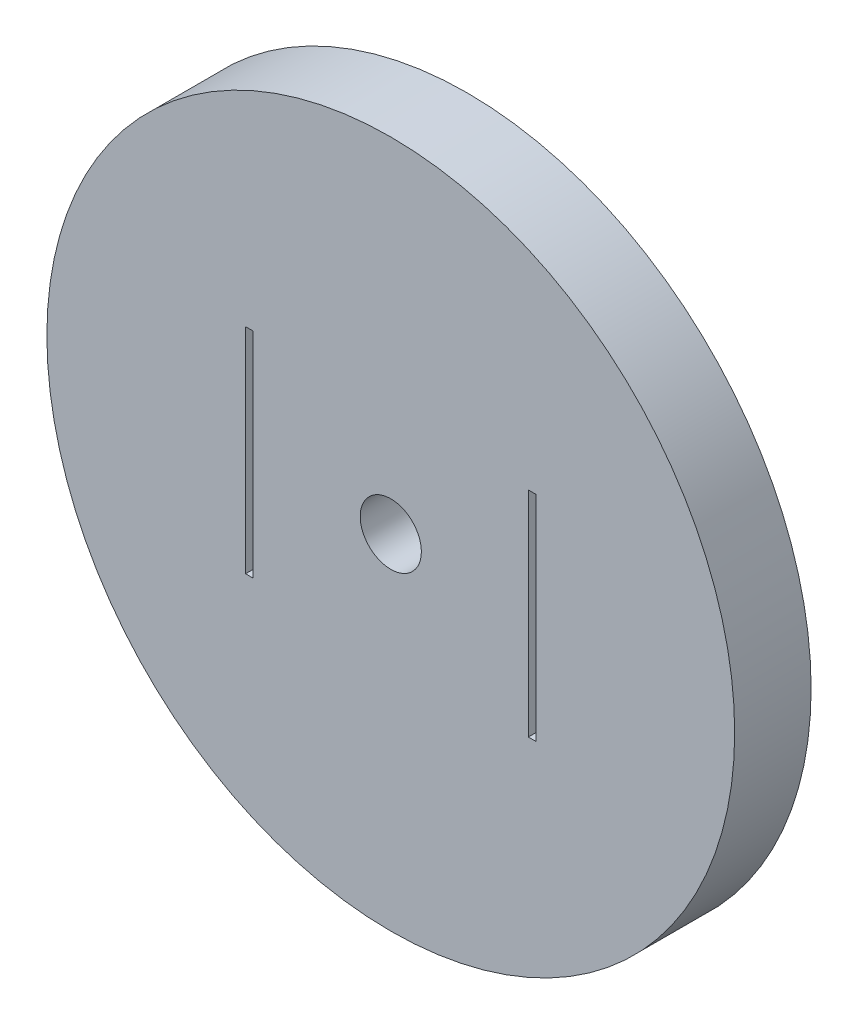
from build123d import *

# Parameters (mm, degrees)
SKETCH1_R           = 22.5
SKETCH1_R_2         = 2
SKETCH1_W           = 0.5
SKETCH1_H           = 14
BOSS_EXTRUDE1_DEPTH = 5


with BuildPart() as part:
    # Sketch1 → Boss-Extrude1 (new body)
    with BuildSketch(Plane.XY):
        Circle(SKETCH1_R)
        Circle(SKETCH1_R_2, mode=Mode.SUBTRACT)
        with Locations((-9.25, 0)):
            Rectangle(SKETCH1_W, SKETCH1_H, mode=Mode.SUBTRACT)
        with Locations((9.25, 0)):
            Rectangle(SKETCH1_W, SKETCH1_H, mode=Mode.SUBTRACT)
    extrude(amount=BOSS_EXTRUDE1_DEPTH)

    # Sketch3 → Revolve1 (revolve)
    with BuildSketch(Plane(origin=(0, 0, 0), x_dir=(1, 0, 0), z_dir=(0, 1, 0))):
        with BuildLine():
            Line((-17, 9.5), (-17, 0))
            Line((-17, 0), (-14.5, 0))
            Line((-14.5, 0), (-14.5, 12))
            ThreePointArc((-14.5, 12), (-16.267766953, 11.267766953), (-17, 9.5))
        make_face()
    revolve(axis=Axis((-14.5, 0, -9.5), (0, 0, 1)))


solid = part.part
